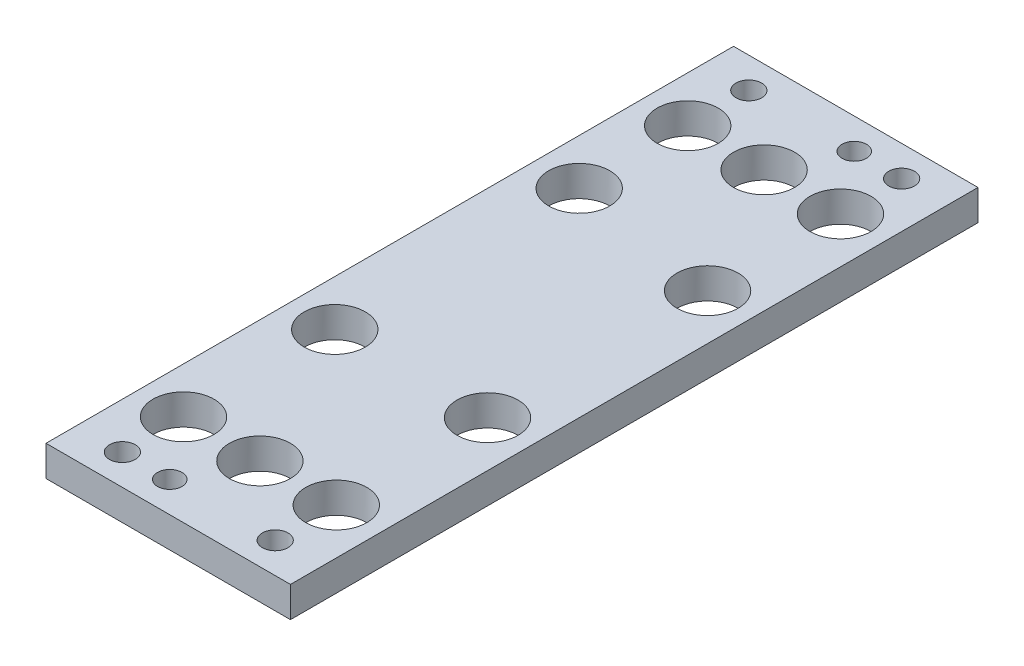
from build123d import *

# Parameters (mm, degrees)
SKETCH1_W             = 80
SKETCH1_H             = 225
BOSS_EXTRUDE1_DEPTH   = 10
CUT_EXTRUDE1_REACH    = 121.818
SKETCH2_R             = 10
M8_CLEARANCE_HOLE1_D  = 8.4
F_8_0MM_DOWEL_HOLE1_D = 8


with BuildPart() as part:
    # Sketch1 → Boss-Extrude1 (new body)
    with BuildSketch(Plane(origin=(0, 0, 0), x_dir=(1, 0, 0), z_dir=(0, 1, 0))):
        Rectangle(SKETCH1_W, SKETCH1_H)
    extrude(amount=-BOSS_EXTRUDE1_DEPTH)

    # Sketch2 → Cut-Extrude1 (cut, up to next)
    with BuildSketch(Plane(origin=(0, 0, 0), x_dir=(1, 0, 0), z_dir=(0, 1, 0)), mode=Mode.PRIVATE) as cut_extrude1_sk1:
        with Locations((25, -82.5)):
            Circle(SKETCH2_R)
    cut_extrude1_tool1 = extrude(cut_extrude1_sk1.sketch, amount=-CUT_EXTRUDE1_REACH, mode=Mode.PRIVATE) & part.part
    # Sketch2 → Cut-Extrude1 (cut, up to next)
    with BuildSketch(Plane(origin=(0, 0, 0), x_dir=(1, 0, 0), z_dir=(0, 1, 0)), mode=Mode.PRIVATE) as cut_extrude1_sk2:
        with Locations((0, -82.5)):
            Circle(SKETCH2_R)
    cut_extrude1_tool2 = extrude(cut_extrude1_sk2.sketch, amount=-CUT_EXTRUDE1_REACH, mode=Mode.PRIVATE) & part.part
    # Sketch2 → Cut-Extrude1 (cut, up to next)
    with BuildSketch(Plane(origin=(0, 0, 0), x_dir=(1, 0, 0), z_dir=(0, 1, 0)), mode=Mode.PRIVATE) as cut_extrude1_sk3:
        with Locations((-25, -82.5)):
            Circle(SKETCH2_R)
    cut_extrude1_tool3 = extrude(cut_extrude1_sk3.sketch, amount=-CUT_EXTRUDE1_REACH, mode=Mode.PRIVATE) & part.part
    # Sketch2 → Cut-Extrude1 (cut, up to next)
    with BuildSketch(Plane(origin=(0, 0, 0), x_dir=(1, 0, 0), z_dir=(0, 1, 0)), mode=Mode.PRIVATE) as cut_extrude1_sk4:
        with Locations((25, -33)):
            Circle(SKETCH2_R)
    cut_extrude1_tool4 = extrude(cut_extrude1_sk4.sketch, amount=-CUT_EXTRUDE1_REACH, mode=Mode.PRIVATE) & part.part
    # Sketch2 → Cut-Extrude1 (cut, up to next)
    with BuildSketch(Plane(origin=(0, 0, 0), x_dir=(1, 0, 0), z_dir=(0, 1, 0)), mode=Mode.PRIVATE) as cut_extrude1_sk5:
        with Locations((-25, -33)):
            Circle(SKETCH2_R)
    cut_extrude1_tool5 = extrude(cut_extrude1_sk5.sketch, amount=-CUT_EXTRUDE1_REACH, mode=Mode.PRIVATE) & part.part
    # Sketch2 → Cut-Extrude1 (cut, up to next)
    with BuildSketch(Plane(origin=(0, 0, 0), x_dir=(1, 0, 0), z_dir=(0, 1, 0)), mode=Mode.PRIVATE) as cut_extrude1_sk6:
        with Locations((25, 39)):
            Circle(SKETCH2_R)
    cut_extrude1_tool6 = extrude(cut_extrude1_sk6.sketch, amount=-CUT_EXTRUDE1_REACH, mode=Mode.PRIVATE) & part.part
    # Sketch2 → Cut-Extrude1 (cut, up to next)
    with BuildSketch(Plane(origin=(0, 0, 0), x_dir=(1, 0, 0), z_dir=(0, 1, 0)), mode=Mode.PRIVATE) as cut_extrude1_sk7:
        with Locations((-25, 47)):
            Circle(SKETCH2_R)
    cut_extrude1_tool7 = extrude(cut_extrude1_sk7.sketch, amount=-CUT_EXTRUDE1_REACH, mode=Mode.PRIVATE) & part.part
    # Sketch2 → Cut-Extrude1 (cut, up to next)
    with BuildSketch(Plane(origin=(0, 0, 0), x_dir=(1, 0, 0), z_dir=(0, 1, 0)), mode=Mode.PRIVATE) as cut_extrude1_sk8:
        with Locations((-25, 82.5)):
            Circle(SKETCH2_R)
    cut_extrude1_tool8 = extrude(cut_extrude1_sk8.sketch, amount=-CUT_EXTRUDE1_REACH, mode=Mode.PRIVATE) & part.part
    # Sketch2 → Cut-Extrude1 (cut, up to next)
    with BuildSketch(Plane(origin=(0, 0, 0), x_dir=(1, 0, 0), z_dir=(0, 1, 0)), mode=Mode.PRIVATE) as cut_extrude1_sk9:
        with Locations((0, 82.5)):
            Circle(SKETCH2_R)
    cut_extrude1_tool9 = extrude(cut_extrude1_sk9.sketch, amount=-CUT_EXTRUDE1_REACH, mode=Mode.PRIVATE) & part.part
    # Sketch2 → Cut-Extrude1 (cut, up to next)
    with BuildSketch(Plane(origin=(0, 0, 0), x_dir=(1, 0, 0), z_dir=(0, 1, 0)), mode=Mode.PRIVATE) as cut_extrude1_sk10:
        with Locations((25, 82.5)):
            Circle(SKETCH2_R)
    cut_extrude1_tool10 = extrude(cut_extrude1_sk10.sketch, amount=-CUT_EXTRUDE1_REACH, mode=Mode.PRIVATE) & part.part
    add(cut_extrude1_tool1.solids().sort_by_distance((25, 0, 82.5))[0], mode=Mode.SUBTRACT)
    add(cut_extrude1_tool2.solids().sort_by_distance((0, 0, 82.5))[0], mode=Mode.SUBTRACT)
    add(cut_extrude1_tool3.solids().sort_by_distance((-25, 0, 82.5))[0], mode=Mode.SUBTRACT)
    add(cut_extrude1_tool4.solids().sort_by_distance((25, 0, 33))[0], mode=Mode.SUBTRACT)
    add(cut_extrude1_tool5.solids().sort_by_distance((-25, 0, 33))[0], mode=Mode.SUBTRACT)
    add(cut_extrude1_tool6.solids().sort_by_distance((25, 0, -39))[0], mode=Mode.SUBTRACT)
    add(cut_extrude1_tool7.solids().sort_by_distance((-25, 0, -47))[0], mode=Mode.SUBTRACT)
    add(cut_extrude1_tool8.solids().sort_by_distance((-25, 0, -82.5))[0], mode=Mode.SUBTRACT)
    add(cut_extrude1_tool9.solids().sort_by_distance((0, 0, -82.5))[0], mode=Mode.SUBTRACT)
    add(cut_extrude1_tool10.solids().sort_by_distance((25, 0, -82.5))[0], mode=Mode.SUBTRACT)

    # M8 Clearance Hole1 (through all)
    with Locations(Plane(origin=(0, 0, 0), x_dir=(1, 0, 0), z_dir=(0, 1, 0))):
        with Locations((25, -102.5), (-25, -102.5), (25, 102.5), (-25, 102.5)):
            Hole(M8_CLEARANCE_HOLE1_D / 2)

    # Ø8.0mm Dowel Hole1 (through all)
    with Locations(Plane(origin=(0, 0, 0), x_dir=(1, 0, 0), z_dir=(0, 1, 0))):
        with Locations((-9.5, -102.5), (9.5, 102.5)):
            Hole(F_8_0MM_DOWEL_HOLE1_D / 2)


solid = part.part
